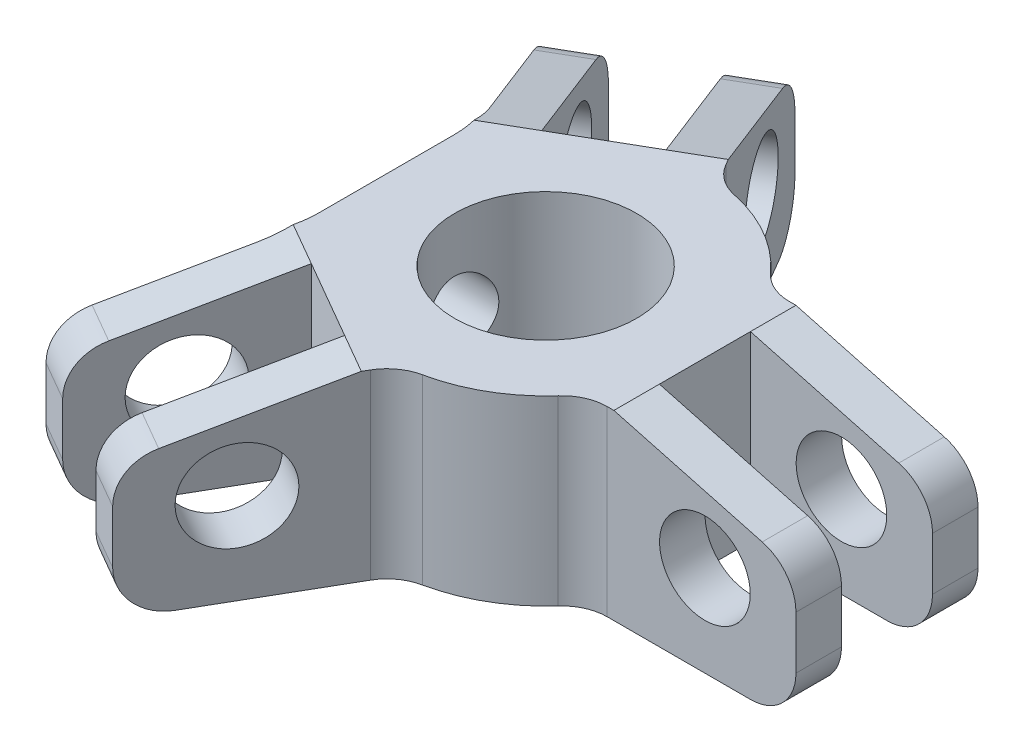
from build123d import *

# Parameters (mm, degrees)
SKETCH1_R                             = 11.1125
SKETCH1_R_2                           = 6.35
BOSS_EXTRUDE1_DEPTH                   = 12.7
SKETCH4_R                             = 3.1623
BOSS_EXTRUDE2_DEPTH                   = 6.35
SKETCH5_W                             = 12.7
SKETCH5_H                             = 6.35
CUT_EXTRUDE1_DEPTH                    = 30.185832393
CIRPATTERN1_COUNT                     = 3
FILLET2_R                             = 3.175
BOSS_EXTRUDE3_START                   = -12.7
BOSS_EXTRUDE3_DEPTH                   = 12.7
CUT_EXTRUDE2_REACH                    = 43.809
CUT_EXTRUDE3_DEPTH                    = 42.808737587
CUT_EXTRUDE3_DEPTH_BACK               = 42.808737587
TAPPED_HOLE_FOR_10_32_HELICOIL1_D     = 5.1054
TAPPED_HOLE_FOR_10_32_HELICOIL1_DEPTH = 11.9888
TAPPED_HOLE_FOR_10_32_HELICOIL1_TIP   = 1.533816902


# Read off the part's stored shape, not the designer's step: Boss-Extrude3
with BuildPart() as part:
    # Sketch1 → Boss-Extrude1 (new body)
    with BuildSketch(Plane(origin=(0, 0, 0), x_dir=(1, 0, 0), z_dir=(0, 1, 0))):
        with Locations(Location((0, 0, 0), (0, 0, 270))):
            Circle(SKETCH1_R)
        with Locations(Location((0, 0, 0), (0, 0, 270))):
            Circle(SKETCH1_R_2, mode=Mode.SUBTRACT)
    extrude(amount=BOSS_EXTRUDE1_DEPTH)

    # Sketch4 → Boss-Extrude2 (add, symmetric)
    with BuildSketch(Plane.XY):
        Polygon((11.1125, 12.7), (23.8125, 9.297045256), (23.8125, 3.402954744), (23.8125, 0), (11.1125, 0), (8.73125, 0), (8.73125, 12.7), align=None)
        with Locations((17.4625, 6.35)):
            Circle(SKETCH4_R, mode=Mode.SUBTRACT)
    boss_extrude2 = extrude(amount=BOSS_EXTRUDE2_DEPTH, both=True)

    # Sketch5 → Cut-Extrude1 (cut, through all)
    with BuildSketch(Plane(origin=(0, 12.7, 0), x_dir=(1, 0, 0), z_dir=(0, 1, 0))):
        with Locations((17.4625, 0)):
            Rectangle(SKETCH5_W, SKETCH5_H)
    cut_extrude1 = extrude(amount=-CUT_EXTRUDE1_DEPTH, mode=Mode.SUBTRACT)

    # CirPattern1: Boss-Extrude2, Cut-Extrude1 ×3 about axis
    cirpattern1_axis = Axis((0, 0, 0), (0, 1, 0))
    add([boss_extrude2.rotate(cirpattern1_axis, i * 360 / CIRPATTERN1_COUNT) for i in range(1, CIRPATTERN1_COUNT)])
    add([cut_extrude1.rotate(cirpattern1_axis, i * 360 / CIRPATTERN1_COUNT) for i in range(1, CIRPATTERN1_COUNT)], mode=Mode.SUBTRACT)

    # Fillet2
    fillet2_edges = [part.edges().sort_by_distance(p)[0] for p in [
        (9.119493201, 6.35, -6.35),
        (9.119493201, 6.35, 6.35),
        (-16.030695986, 9.297045256, -18.240979928),
        (-16.030695986, 0, -18.240979928),
        (-7.781804014, 9.297045256, 23.003479928),
        (-7.781804014, 0, 23.003479928),
        (23.8125, 9.297045256, 4.7625),
        (23.8125, 0, 4.7625),
        (23.8125, 9.297045256, -4.7625),
        (23.8125, 0, -4.7625),
        (0.939514713, 6.35, 11.072712782),
        (-16.030695986, 9.297045256, 18.240979928),
        (-16.030695986, 0, 18.240979928),
        (0.939514713, 6.35, -11.072712782),
        (-7.781804014, 9.297045256, -23.003479928),
        (-7.781804014, 0, -23.003479928),
    ]]
    fillet(fillet2_edges, radius=FILLET2_R)

    # Boss-Extrude3 outline → Boss-Extrude3 (add)
    with BuildSketch(Plane(origin=(0, 12.7, 0), x_dir=(1, 0, 0), z_dir=(0, 1, 0)).offset(BOSS_EXTRUDE3_START)):
        with BuildLine():
            ThreePointArc((-10.059007915, -4.722712782), (-10.845929691, -2.419393601), (-11.1125, 0))
            Line((-11.1125, 0), (-11.1125, -4.722712782))
            ThreePointArc((-11.1125, -4.722712782), (-11.337716442, -6.459773203), (-11.99847248, -8.081963948))
            Line((-11.99847248, -8.081963948), (-11.055511314, -6.4487073))
            Line((-11.055511314, -6.4487073), (-10.059007915, -4.722712782))
        make_face()
        with BuildLine():
            Line((-11.055511314, 6.4487073), (-11.99847248, 8.081963948))
            ThreePointArc((-11.99847248, 8.081963948), (-11.337716442, 6.459773203), (-11.1125, 4.722712782))
            Line((-11.1125, 4.722712782), (-11.1125, 0))
            ThreePointArc((-11.1125, 0), (-10.845929691, 2.419393601), (-10.059007915, 4.722712782))
            Line((-10.059007915, 4.722712782), (-11.055511314, 6.4487073))
        make_face()
    extrude(amount=BOSS_EXTRUDE3_DEPTH)

    # Sketch9 → Cut-Extrude2 (cut, up to next)
    with BuildSketch(Plane(origin=(-5.499261314, 0, -3.175), x_dir=(-0.500000000000004, 0, 0.8660254037844364), z_dir=(-0.8660254037844365, 0, -0.500000000000004)), mode=Mode.PRIVATE) as cut_extrude2_sk1:
        Polygon((11.1125, 12.7), (12.998422331, 12.194668634), (12.998422331, 12.7), align=None)
    cut_extrude2_tool1 = extrude(cut_extrude2_sk1.sketch, amount=CUT_EXTRUDE2_REACH, mode=Mode.PRIVATE) & part.part
    add(cut_extrude2_tool1.solids().sort_by_distance((-11.684152, 12.531556, 7.537545))[0], mode=Mode.SUBTRACT)

    # Sketch10 → Cut-Extrude3 (cut, two sides: drawn at the far end of the back side and taken through both)
    with BuildSketch(Plane(origin=(-5.499261314, 0, 3.175), x_dir=(0.49999999999999195, 0, 0.8660254037844434), z_dir=(-0.8660254037844434, 0, 0.49999999999999195)).offset(-CUT_EXTRUDE3_DEPTH_BACK)):
        Polygon((-12.998422331, 117.204706423), (-12.998422331, 12.7), (-12.998422331, 12.194668634), (-11.1125, 12.7), (89.831294903, 39.747808325), (215.584349787, 206.694218426), (112.754632553, 284.151116524), align=None)
    extrude(amount=CUT_EXTRUDE3_DEPTH + CUT_EXTRUDE3_DEPTH_BACK, mode=Mode.SUBTRACT)

    # Tapped Hole for #10-32 Helicoil1
    with Locations(Plane.ZY.offset(11.1125)):
        with Locations((0, 6.35)):
            Hole(TAPPED_HOLE_FOR_10_32_HELICOIL1_D / 2, depth=TAPPED_HOLE_FOR_10_32_HELICOIL1_DEPTH)
            with Locations((0, 0, -(TAPPED_HOLE_FOR_10_32_HELICOIL1_DEPTH + TAPPED_HOLE_FOR_10_32_HELICOIL1_TIP / 2))):  # 118° drill point
                Cone(0, TAPPED_HOLE_FOR_10_32_HELICOIL1_D / 2, TAPPED_HOLE_FOR_10_32_HELICOIL1_TIP, mode=Mode.SUBTRACT)


solid = part.part
